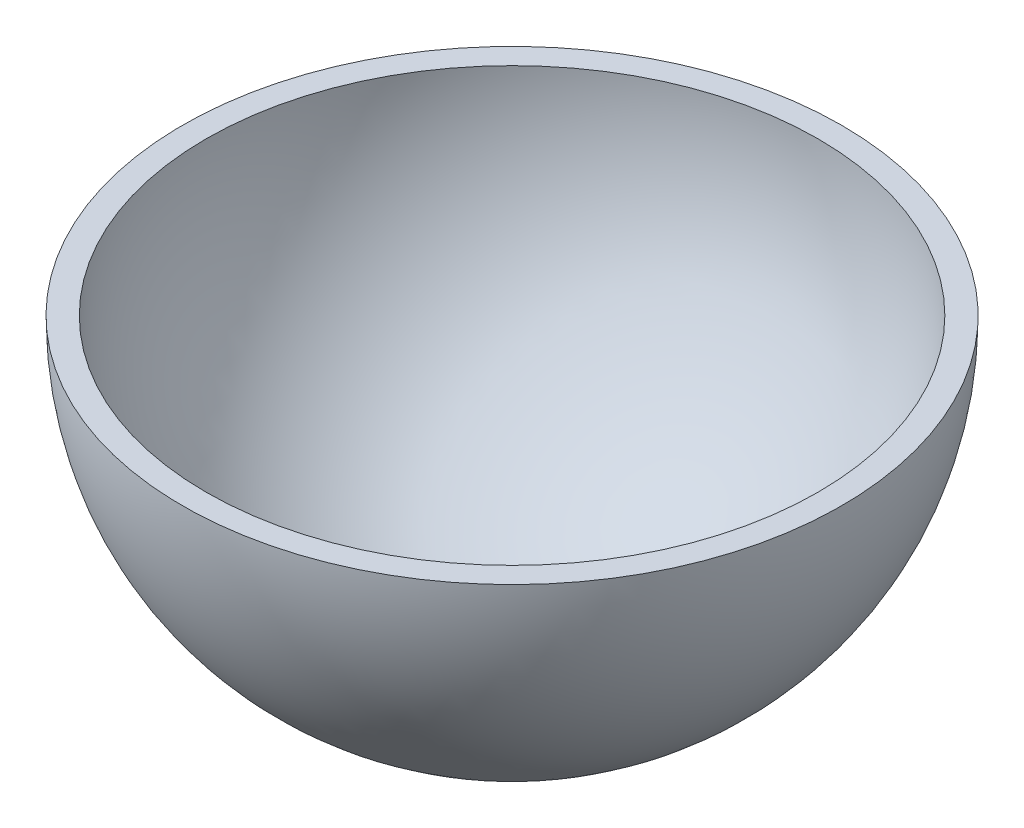
from build123d import *

# Parameters (mm, degrees)
REVOLVE_1_ANGLE = 180


with BuildPart() as part:
    # 草图1 → 旋转1 (revolve)
    with BuildSketch(Plane(origin=(0, 0, 0), x_dir=(1, 0, 0), z_dir=(0, 1, 0))):
        with BuildLine():
            Line((-35, 0), (-32.5, 0))
            ThreePointArc((-32.5, 0), (0, 32.5), (32.5, 0))
            Line((32.5, 0), (35, 0))
            ThreePointArc((35, 0), (0, 35), (-35, 0))
        make_face()
    revolve(axis=Axis((35, 0, 0), (-1, 0, 0)), revolution_arc=REVOLVE_1_ANGLE)


solid = part.part
